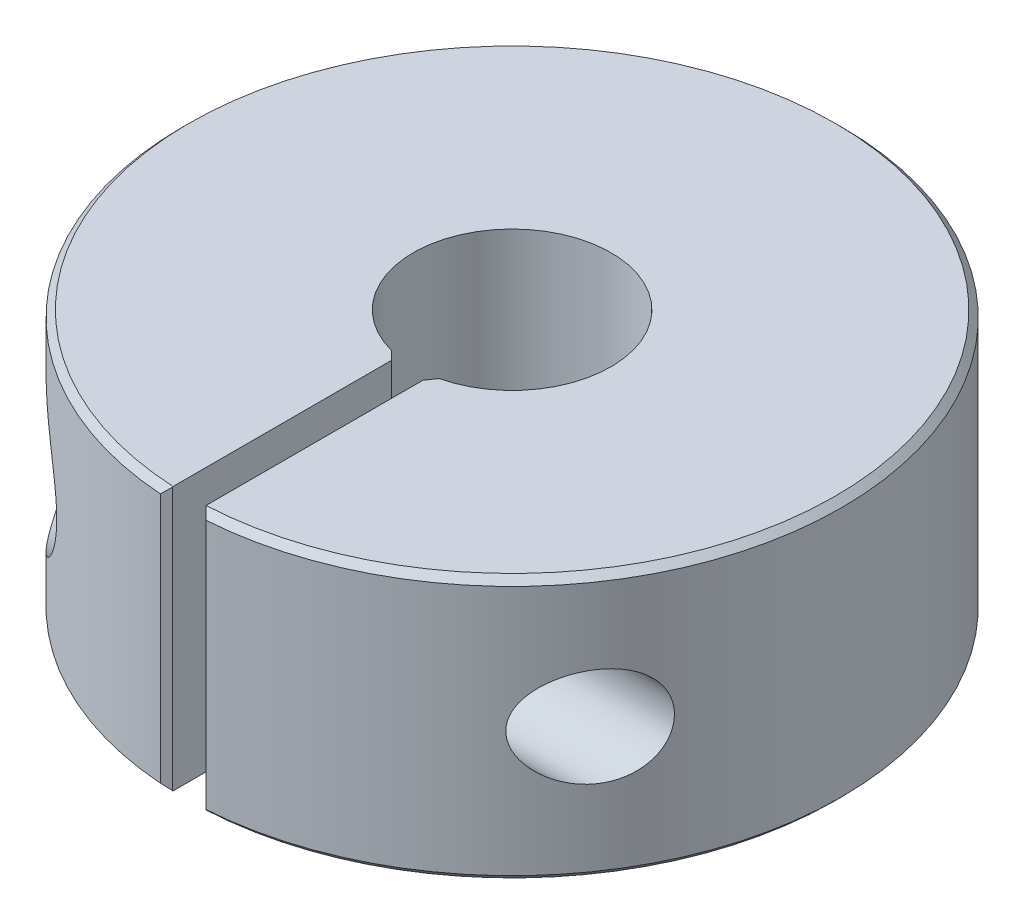
from build123d import *

# Parameters (mm, degrees)
EXTRUDE_1_DEPTH     = 4
CHAMFER_1_SIZE      = 0.2
CHAMFER_1_SIZE_2    = 0.19070336
CHAMFER_1_SIZE_3    = 0.244096934
SKETCH_2_R          = 2.75
CUT_EXTRUDE_1_DEPTH = 17.881943016
SKETCH_3_R          = 1.5
CUT_EXTRUDE_2_DEPTH = 17.881943152


with BuildPart() as part:
    # 草图1 → 凸台-拉伸1 (new, symmetric)
    with BuildSketch(Plane(origin=(0, 0, 0), x_dir=(1, 0, 0), z_dir=(0, 1, 0))):
        with BuildLine():
            Line((-0.5, -2.958039892), (-0.5, -9.987492178))
            ThreePointArc((-0.5, -9.987492178), (0, 10), (0.5, -9.987492178))
            Line((0.5, -9.987492178), (0.5, -2.958039892))
            ThreePointArc((0.5, -2.958039892), (0, 3), (-0.5, -2.958039892))
        make_face()
    extrude(amount=EXTRUDE_1_DEPTH, both=True)

    # 倒角1
    # the kernel refuses this chamfer: 0.244096934, 0.2, 0.19070336 mm, written as the material it takes off along each edge
    with BuildSketch(Plane(origin=(0, 4, 0), x_dir=(-0.0031415874858795653, 0, 0.9999950652018581), z_dir=(0.9999950652018581, 0, 0.0031415874858795653))) as chamfer_1_piece_1:
        Polygon((10 - CHAMFER_1_SIZE, 0), (10, CHAMFER_1_SIZE), (10, 0), align=None)
    revolve(axis=Axis((0, 4, 0), (0, -1, 0)), revolution_arc=359.64, mode=Mode.SUBTRACT)
    with BuildSketch(Plane(origin=(0, -4, 0), x_dir=(-0.0031415874858795653, 0, 0.9999950652018581), z_dir=(0.9999950652018581, 0, 0.0031415874858795653))) as chamfer_1_piece_2:
        Polygon((10, -CHAMFER_1_SIZE), (10 - CHAMFER_1_SIZE, 0), (10, 0), align=None)
    revolve(axis=Axis((0, -4, 0), (0, -1, 0)), revolution_arc=359.64, mode=Mode.SUBTRACT)
    with BuildSketch(Plane(origin=(-0.5, -4.671168093, 2.958039892), x_dir=(0, 0, 1), z_dir=(0, 1, 0))) as chamfer_1_piece_3:
        with BuildLine():
            Line((CHAMFER_1_SIZE, 0), (-0.054456761, -0.254456761))
            ThreePointArc((-0.054456761, -0.254456761), (-0.025330071, -0.131833133), (0, 0))
            Line((0, 0), (CHAMFER_1_SIZE, 0))
        make_face()
    extrude(amount=9.342336186, mode=Mode.SUBTRACT)
    with BuildSketch(Plane(origin=(-0.5, 4.50932304, 9.987492178), x_dir=(0, 0, -1), z_dir=(0, -1, 0))) as chamfer_1_piece_4:
        with BuildLine():
            Line((CHAMFER_1_SIZE_2 * 1.00000000187, 0), (0.01186065, -0.197693077))
            ThreePointArc((0.01186065, -0.197693077), (0.005608956, -0.101670471), (0, 0))
            Line((0, 0), (CHAMFER_1_SIZE_2 * 1.00000000187, 0))
        make_face()
    extrude(amount=9.01864608, mode=Mode.SUBTRACT)
    with BuildSketch(Plane(origin=(0.5, 4.514336598, 9.987492178), x_dir=(0, 0, -1), z_dir=(0, -1, 0))) as chamfer_1_piece_5:
        with BuildLine():
            Line((CHAMFER_1_SIZE, 0), (0.011239899, 0.188760101))
            ThreePointArc((0.011239899, 0.188760101), (0.005331916, 0.097056531), (0, 0))
            Line((0, 0), (CHAMFER_1_SIZE, 0))
        make_face()
    extrude(amount=9.028673195, mode=Mode.SUBTRACT)
    with BuildSketch(Plane(origin=(0.5, -4.630296565, 2.958039892), x_dir=(0, 0, 1), z_dir=(0, 1, 0))) as chamfer_1_piece_6:
        with BuildLine():
            Line((CHAMFER_1_SIZE_3 * 0.999999998038, 0), (-0.041587873, 0.203070142))
            ThreePointArc((-0.041587873, 0.203070142), (-0.019758938, 0.105396594), (0, 0))
            Line((0, 0), (CHAMFER_1_SIZE_3 * 0.999999998038, 0))
        make_face()
    extrude(amount=9.26059313, mode=Mode.SUBTRACT)

    # 草图2 → 切除-拉伸1 (cut, through all)
    with BuildSketch(Plane(origin=(-3, 0, 0), x_dir=(0, 0, -1), z_dir=(1, 0, 0))):
        with Locations((-5.666452018, 0)):
            Circle(SKETCH_2_R)
    extrude(amount=-CUT_EXTRUDE_1_DEPTH, mode=Mode.SUBTRACT)

    # 草图3 → 切除-拉伸2 (cut, through all)
    with BuildSketch(Plane(origin=(-3, 0, 0), x_dir=(0, 0, -1), z_dir=(1, 0, 0))):
        with Locations(Location((-5.666452018, 0, 0), (0, 0, 180))):
            Circle(SKETCH_3_R)
    extrude(amount=CUT_EXTRUDE_2_DEPTH, mode=Mode.SUBTRACT)


solid = part.part
